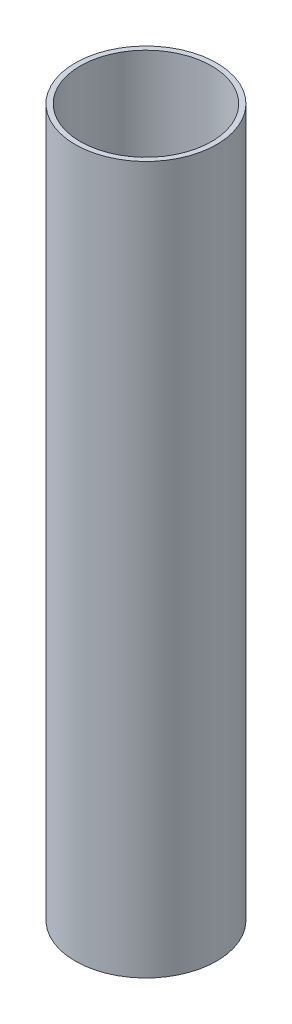
from build123d import *

# Parameters (mm, degrees)
SKETCH1_R           = 25
SKETCH1_R_2         = 23.2
BOSS_EXTRUDE1_DEPTH = 125


with BuildPart() as part:
    # Sketch1 → Boss-Extrude1 (new, symmetric)
    with BuildSketch(Plane(origin=(0, 0, 0), x_dir=(1, 0, 0), z_dir=(0, 1, 0))):
        Circle(SKETCH1_R)
        Circle(SKETCH1_R_2, mode=Mode.SUBTRACT)
    extrude(amount=BOSS_EXTRUDE1_DEPTH, both=True)


solid = part.part
